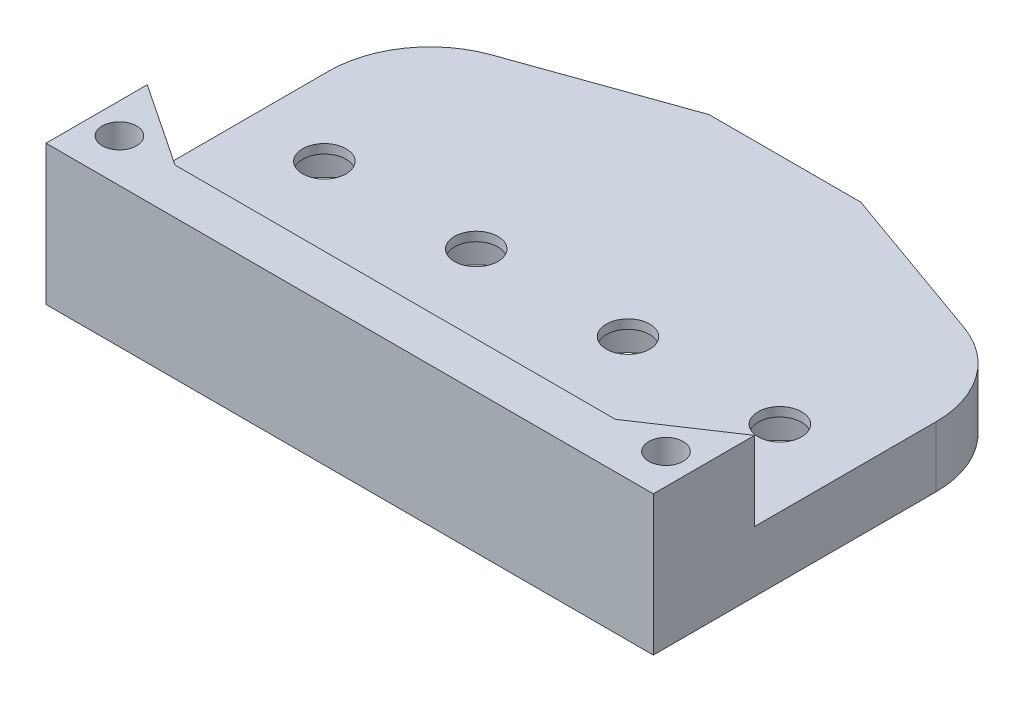
from build123d import *

# Parameters (mm, degrees)
SKETCH2_R           = 2.15
BOSS_EXTRUDE1_DEPTH = 6
BOSS_EXTRUDE2_DEPTH = 7.8
SKETCH4_R           = 1.7
CUT_EXTRUDE1_DEPTH  = 76.096204964
SKETCH5_R           = 6.55
CUT_EXTRUDE2_DEPTH  = 5.1
FILLET1_R           = 10


with BuildPart() as part:
    # Sketch2 → Boss-Extrude1 (new body)
    with BuildSketch(Plane(origin=(0, 0, 0), x_dir=(1, 0, 0), z_dir=(0, 1, 0))):
        Polygon((0, 0), (0, 35), (22.5, 43), (37.5, 43), (60, 35), (60, 0), align=None)
        with Locations((7.5, 20)):
            Circle(SKETCH2_R, mode=Mode.SUBTRACT)
        with Locations((22.5, 20)):
            Circle(SKETCH2_R, mode=Mode.SUBTRACT)
        with Locations((37.5, 20)):
            Circle(SKETCH2_R, mode=Mode.SUBTRACT)
        with Locations((52.5, 20)):
            Circle(SKETCH2_R, mode=Mode.SUBTRACT)
    extrude(amount=BOSS_EXTRUDE1_DEPTH)

    # Sketch3 → Boss-Extrude2 (add)
    with BuildSketch(Plane(origin=(0, 6, 0), x_dir=(1, 0, 0), z_dir=(0, 1, 0))):
        Polygon((0, 10), (0, 0), (60, 0), (60, 10), (51.75, 4.5), (8.25, 4.5), align=None)
    extrude(amount=BOSS_EXTRUDE2_DEPTH)

    # Sketch4 → Cut-Extrude1 (cut, through all)
    with BuildSketch(Plane(origin=(0, 13.8, 0), x_dir=(1, 0, 0), z_dir=(0, 1, 0))):
        with Locations((3, 4.25)):
            Circle(SKETCH4_R)
        with Locations((57, 4.25)):
            Circle(SKETCH4_R)
    extrude(amount=-CUT_EXTRUDE1_DEPTH, mode=Mode.SUBTRACT)

    # Sketch5 → Cut-Extrude2 (cut)
    with BuildSketch(Plane(origin=(0, 0, 0), x_dir=(1, 0, 0), z_dir=(0, 1, 0))):
        with Locations((7.5, 20)):
            Circle(SKETCH5_R)
        with Locations((22.5, 20)):
            Circle(SKETCH5_R)
        with Locations((37.5, 20)):
            Circle(SKETCH5_R)
        with Locations((52.5, 20)):
            Circle(SKETCH5_R)
    extrude(amount=CUT_EXTRUDE2_DEPTH, mode=Mode.SUBTRACT)

    # Fillet1
    fillet1_edges = [part.edges().sort_by_distance(p)[0] for p in [
        (0, 3, -35),
        (60, 3, -35),
    ]]
    fillet(fillet1_edges, radius=FILLET1_R)


solid = part.part
